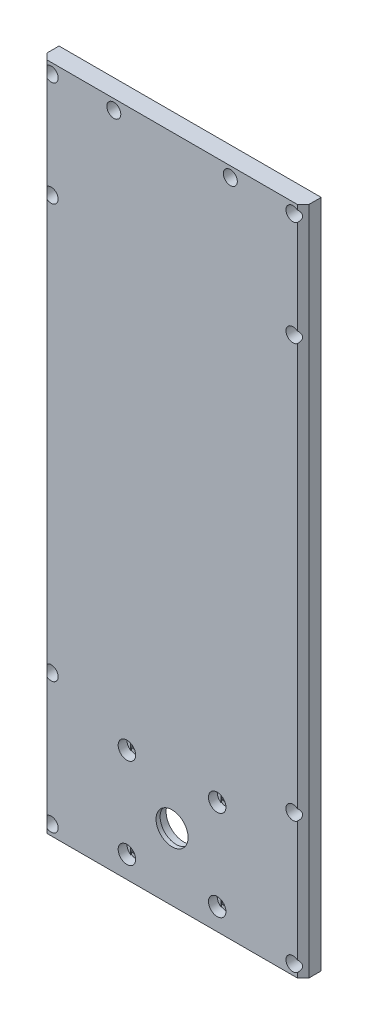
from build123d import *

# Parameters (mm, degrees)
SKETCH1_W           = 90
SKETCH1_H           = 230
SKETCH1_W_2         = 76
SKETCH1_H_2         = 216
BOSS_EXTRUDE1_DEPTH = 7
SKETCH2_W           = 76
SKETCH2_H           = 36
BOSS_EXTRUDE2_DEPTH = 7
SKETCH3_R           = 5.5
CUT_EXTRUDE1_DEPTH  = 124.689126442
SKETCH4_R           = 6.05
CUT_EXTRUDE2_DEPTH  = 5.6
SKETCH5_R           = 12
CUT_EXTRUDE3_DEPTH  = 3
SKETCH6_R           = 1.7
CUT_EXTRUDE4_DEPTH  = 124.689126442
SKETCH7_W           = 60
SKETCH7_H           = 40
CUT_EXTRUDE5_DEPTH  = 1
SKETCH8_R           = 3
CUT_EXTRUDE6_DEPTH  = 3
SKETCH9_R           = 1.45
CUT_EXTRUDE7_DEPTH  = 124.689126442
SKETCH10_R          = 2.4
CUT_EXTRUDE8_DEPTH  = 5
CHAMFER1_SIZE       = 2
SKETCH11_W          = 76
SKETCH11_H          = 35.6
BOSS_EXTRUDE3_DEPTH = 7
SKETCH12_R          = 1.45
CUT_EXTRUDE9_DEPTH  = 124.689126442
SKETCH13_R          = 2.4
CUT_EXTRUDE10_DEPTH = 5
CHAMFER2_SIZE       = 0.8
CUT_EXTRUDE11_DEPTH = 0.2
SKETCH15_W          = 2.9
SKETCH15_H          = 2.9
CUT_EXTRUDE12_DEPTH = 0.2
CUT_EXTRUDE13_DEPTH = 0.2
SKETCH17_W          = 3.4
SKETCH17_H          = 3.4
CUT_EXTRUDE14_DEPTH = 0.2
BOSS_EXTRUDE4_START = -7
SKETCH18_W          = 77.6
SKETCH18_H          = 38
BOSS_EXTRUDE4_DEPTH = 7
CHAMFER3_SIZE       = 0.8
SKETCH19_W          = 77.6
SKETCH19_H          = 108.8
BOSS_EXTRUDE5_DEPTH = 7


with BuildPart() as part:
    # Sketch1 → Boss-Extrude1 (new body)
    with BuildSketch(Plane.XY):
        Rectangle(SKETCH1_W, SKETCH1_H)
        Rectangle(SKETCH1_W_2, SKETCH1_H_2, mode=Mode.SUBTRACT)
    extrude(amount=BOSS_EXTRUDE1_DEPTH)

    # Sketch2 → Boss-Extrude2 (add)
    with BuildSketch(Plane.XY.offset(7)):
        with Locations((0, -90)):
            Rectangle(SKETCH2_W, SKETCH2_H)
    extrude(amount=-BOSS_EXTRUDE2_DEPTH)

    # Sketch3 → Cut-Extrude1 (cut, through all)
    with BuildSketch(Plane(origin=(0, 0, 0), x_dir=(-1, 0, 0), z_dir=(0, 0, -1))):
        with Locations((0, -92)):
            Circle(SKETCH3_R)
    extrude(amount=-CUT_EXTRUDE1_DEPTH, mode=Mode.SUBTRACT)

    # Sketch4 → Cut-Extrude2 (cut)
    with BuildSketch(Plane(origin=(0, 0, 0), x_dir=(-1, 0, 0), z_dir=(0, 0, -1))):
        with Locations((0, -92)):
            Circle(SKETCH4_R)
    extrude(amount=-CUT_EXTRUDE2_DEPTH, mode=Mode.SUBTRACT)

    # Sketch5 → Cut-Extrude3 (cut)
    with BuildSketch(Plane(origin=(0, 0, 0), x_dir=(-1, 0, 0), z_dir=(0, 0, -1))):
        with Locations((0, -92)):
            Circle(SKETCH5_R)
    extrude(amount=-CUT_EXTRUDE3_DEPTH, mode=Mode.SUBTRACT)

    # Sketch6 → Cut-Extrude4 (cut, through all)
    with BuildSketch(Plane(origin=(0, 0, 0), x_dir=(-1, 0, 0), z_dir=(0, 0, -1))):
        with Locations((-15.5, -76.5)):
            Circle(SKETCH6_R)
        with Locations((15.5, -76.5)):
            Circle(SKETCH6_R)
        with Locations((15.5, -107.5)):
            Circle(SKETCH6_R)
        with Locations((-15.5, -107.5)):
            Circle(SKETCH6_R)
    extrude(amount=-CUT_EXTRUDE4_DEPTH, mode=Mode.SUBTRACT)

    # Sketch7 → Cut-Extrude5 (cut)
    with BuildSketch(Plane(origin=(0, 0, 0), x_dir=(-1, 0, 0), z_dir=(0, 0, -1))):
        with Locations((0, -92)):
            Rectangle(SKETCH7_W, SKETCH7_H)
    extrude(amount=-CUT_EXTRUDE5_DEPTH, mode=Mode.SUBTRACT)

    # Sketch8 → Cut-Extrude6 (cut)
    with BuildSketch(Plane.XY.offset(7)):
        with Locations((-15.5, -76.5)):
            Circle(SKETCH8_R)
        with Locations((15.5, -76.5)):
            Circle(SKETCH8_R)
        with Locations((15.5, -107.5)):
            Circle(SKETCH8_R)
        with Locations((-15.5, -107.5)):
            Circle(SKETCH8_R)
    extrude(amount=-CUT_EXTRUDE6_DEPTH, mode=Mode.SUBTRACT)

    # Sketch9 → Cut-Extrude7 (cut, through all)
    with BuildSketch(Plane.XY.offset(7)):
        with Locations((-41.5, 111.5)):
            Circle(SKETCH9_R)
        with Locations((41.5, 111.5)):
            Circle(SKETCH9_R)
        with Locations((-41.5, -111.5)):
            Circle(SKETCH9_R)
        with Locations((41.5, -111.5)):
            Circle(SKETCH9_R)
        with Locations((-41.5, 75.5)):
            Circle(SKETCH9_R)
        with Locations((41.5, 75.5)):
            Circle(SKETCH9_R)
        with Locations((41.5, -66.5)):
            Circle(SKETCH9_R)
        with Locations((-41.5, -66.5)):
            Circle(SKETCH9_R)
    extrude(amount=-CUT_EXTRUDE7_DEPTH, mode=Mode.SUBTRACT)

    # Sketch10 → Cut-Extrude8 (cut)
    with BuildSketch(Plane.XY.offset(7)):
        with Locations((-41.5, 111.5)):
            Circle(SKETCH10_R)
        with Locations((41.5, 75.5)):
            Circle(SKETCH10_R)
        with Locations((-41.5, 75.5)):
            Circle(SKETCH10_R)
        with Locations((41.5, 111.5)):
            Circle(SKETCH10_R)
        with Locations((-41.5, -111.5)):
            Circle(SKETCH10_R)
        with Locations((41.5, -111.5)):
            Circle(SKETCH10_R)
        with Locations((-41.5, -66.5)):
            Circle(SKETCH10_R)
        with Locations((41.5, -66.5)):
            Circle(SKETCH10_R)
    extrude(amount=-CUT_EXTRUDE8_DEPTH, mode=Mode.SUBTRACT)

    # Chamfer1
    # the kernel refuses this chamfer: 2 mm, written as the material it takes off along each edge
    with BuildSketch(Plane(origin=(-45, 120.143365976, 7), x_dir=(-0.027495876610585623, 0, -0.9996219169112968), z_dir=(0, -1, 0)), Plane(origin=(45, -120.143365976, 7), x_dir=(0.027495876610585623, 0, -0.9996219169112968), z_dir=(0, 1, 0))) as chamfer1_piece_1:
        Polygon((CHAMFER1_SIZE * 0.999621916911, CHAMFER1_SIZE * 0.0274958766106), (-CHAMFER1_SIZE * 0.0274958766106, CHAMFER1_SIZE * 0.999621916911), (0, 0), align=None)
    extrude(amount=240.286731952, mode=Mode.SUBTRACT)

    # Sketch11 → Boss-Extrude3 (add)
    with BuildSketch(Plane.XY.offset(7)):
        with Locations((0, -54.2)):
            Rectangle(SKETCH11_W, SKETCH11_H)
    extrude(amount=-BOSS_EXTRUDE3_DEPTH)

    # Sketch12 → Cut-Extrude9 (cut, through all)
    with BuildSketch(Plane.XY.offset(7)):
        with Locations((-20, 111.5)):
            Circle(SKETCH12_R)
        with Locations((20, 111.5)):
            Circle(SKETCH12_R)
    extrude(amount=-CUT_EXTRUDE9_DEPTH, mode=Mode.SUBTRACT)

    # Sketch13 → Cut-Extrude10 (cut)
    with BuildSketch(Plane.XY.offset(7)):
        with Locations((-20, 111.5)):
            Circle(SKETCH13_R)
        with Locations((20, 111.5)):
            Circle(SKETCH13_R)
    extrude(amount=-CUT_EXTRUDE10_DEPTH, mode=Mode.SUBTRACT)

    # Chamfer2
    chamfer2_edges = [part.edges().sort_by_distance(p)[0] for p in [
        (0, 108, 0),
        (-38, 35.8, 0),
        (0, 108, 7),
        (-38, 35.8, 7),
        (38, 35.8, 7),
        (38, 35.8, 0),
        (0, -36.4, 7),
        (0, -36.4, 0),
        (0, -115, 0),
        (-45, 0, 0),
        (0, 115, 0),
        (45, 0, 0),
    ]]
    chamfer(chamfer2_edges, length=CHAMFER2_SIZE)

    # Sketch14 → Cut-Extrude11 (cut)
    with BuildSketch(Plane.XY.offset(2)):
        with BuildLine():
            Line((-42.95, -68.41245915), (-42.95, -64.58754085))
            ThreePointArc((-42.95, -64.58754085), (-41.5, -64.1), (-40.05, -64.58754085))
            Line((-40.05, -64.58754085), (-40.05, -68.41245915))
            ThreePointArc((-40.05, -68.41245915), (-41.5, -68.9), (-42.95, -68.41245915))
        make_face()
        with BuildLine():
            Line((-42.95, -113.41245915), (-42.95, -109.58754085))
            ThreePointArc((-42.95, -109.58754085), (-41.5, -109.1), (-40.05, -109.58754085))
            Line((-40.05, -109.58754085), (-40.05, -113.41245915))
            ThreePointArc((-40.05, -113.41245915), (-41.5, -113.9), (-42.95, -113.41245915))
        make_face()
        with BuildLine():
            Line((-42.95, 73.58754085), (-42.95, 77.41245915))
            ThreePointArc((-42.95, 77.41245915), (-41.5, 77.9), (-40.05, 77.41245915))
            Line((-40.05, 77.41245915), (-40.05, 73.58754085))
            ThreePointArc((-40.05, 73.58754085), (-41.5, 73.1), (-42.95, 73.58754085))
        make_face()
        with BuildLine():
            Line((-21.45, 109.58754085), (-21.45, 113.41245915))
            ThreePointArc((-21.45, 113.41245915), (-20, 113.9), (-18.55, 113.41245915))
            Line((-18.55, 113.41245915), (-18.55, 109.58754085))
            ThreePointArc((-18.55, 109.58754085), (-20, 109.1), (-21.45, 109.58754085))
        make_face()
        with BuildLine():
            Line((-42.95, 109.58754085), (-42.95, 113.41245915))
            ThreePointArc((-42.95, 113.41245915), (-41.5, 113.9), (-40.05, 113.41245915))
            Line((-40.05, 113.41245915), (-40.05, 109.58754085))
            ThreePointArc((-40.05, 109.58754085), (-41.5, 109.1), (-42.95, 109.58754085))
        make_face()
    cut_extrude11 = extrude(amount=-CUT_EXTRUDE11_DEPTH, mode=Mode.SUBTRACT)

    # Sketch15 → Cut-Extrude12 (cut)
    with BuildSketch(Plane.XY.offset(1.8)):
        with Locations((-41.5, -111.5)):
            Rectangle(SKETCH15_W, SKETCH15_H)
        with Locations((-41.5, -66.5)):
            Rectangle(SKETCH15_W, SKETCH15_H)
        with Locations((-41.5, 75.5)):
            Rectangle(SKETCH15_W, SKETCH15_H)
        with Locations((-41.5, 111.5)):
            Rectangle(SKETCH15_W, SKETCH15_H)
        with Locations((-20, 111.5)):
            Rectangle(SKETCH15_W, SKETCH15_H)
    cut_extrude12 = extrude(amount=-CUT_EXTRUDE12_DEPTH, mode=Mode.SUBTRACT)

    # Sketch16 → Cut-Extrude13 (cut)
    with BuildSketch(Plane.XY.offset(4)):
        with BuildLine():
            Line((-17.2, -78.971841419), (-17.2, -74.028158581))
            ThreePointArc((-17.2, -74.028158581), (-15.5, -73.5), (-13.8, -74.028158581))
            Line((-13.8, -74.028158581), (-13.8, -78.971841419))
            ThreePointArc((-13.8, -78.971841419), (-15.5, -79.5), (-17.2, -78.971841419))
        make_face()
        with BuildLine():
            Line((-17.2, -109.971841419), (-17.2, -105.028158581))
            ThreePointArc((-17.2, -105.028158581), (-15.5, -104.5), (-13.8, -105.028158581))
            Line((-13.8, -105.028158581), (-13.8, -109.971841419))
            ThreePointArc((-13.8, -109.971841419), (-15.5, -110.5), (-17.2, -109.971841419))
        make_face()
    cut_extrude13 = extrude(amount=-CUT_EXTRUDE13_DEPTH, mode=Mode.SUBTRACT)

    # Sketch17 → Cut-Extrude14 (cut)
    with BuildSketch(Plane.XY.offset(3.8)):
        with Locations((-15.5, -76.5)):
            Rectangle(SKETCH17_W, SKETCH17_H)
        with Locations((-15.5, -107.5)):
            Rectangle(SKETCH17_W, SKETCH17_H)
    cut_extrude14 = extrude(amount=-CUT_EXTRUDE14_DEPTH, mode=Mode.SUBTRACT)

    # Mirror1: Cut-Extrude11, Cut-Extrude12, Cut-Extrude13, Cut-Extrude14 across plane
    add(cut_extrude11.mirror(Plane(origin=(0, 0, 0), x_dir=(0, 0, 1), z_dir=(1, 0, 0))), mode=Mode.SUBTRACT)
    add(cut_extrude12.mirror(Plane(origin=(0, 0, 0), x_dir=(0, 0, 1), z_dir=(1, 0, 0))), mode=Mode.SUBTRACT)
    add(cut_extrude13.mirror(Plane(origin=(0, 0, 0), x_dir=(0, 0, 1), z_dir=(1, 0, 0))), mode=Mode.SUBTRACT)
    add(cut_extrude14.mirror(Plane(origin=(0, 0, 0), x_dir=(0, 0, 1), z_dir=(1, 0, 0))), mode=Mode.SUBTRACT)

    # Sketch18 → Boss-Extrude4 (add)
    with BuildSketch(Plane.XY.offset(7).offset(BOSS_EXTRUDE4_START)):
        with Locations((0, 89.8)):
            Rectangle(SKETCH18_W, SKETCH18_H)
    extrude(amount=BOSS_EXTRUDE4_DEPTH)

    # Chamfer3
    chamfer3_edges = [part.edges().sort_by_distance(p)[0] for p in [
        (0, 70.8, 7),
    ]]
    chamfer(chamfer3_edges, length=CHAMFER3_SIZE)

    # Sketch19 → Boss-Extrude5 (add)
    with BuildSketch(Plane.XY.offset(7)):
        with Locations((0, 17.2)):
            Rectangle(SKETCH19_W, SKETCH19_H)
    extrude(amount=-BOSS_EXTRUDE5_DEPTH)


solid = part.part
